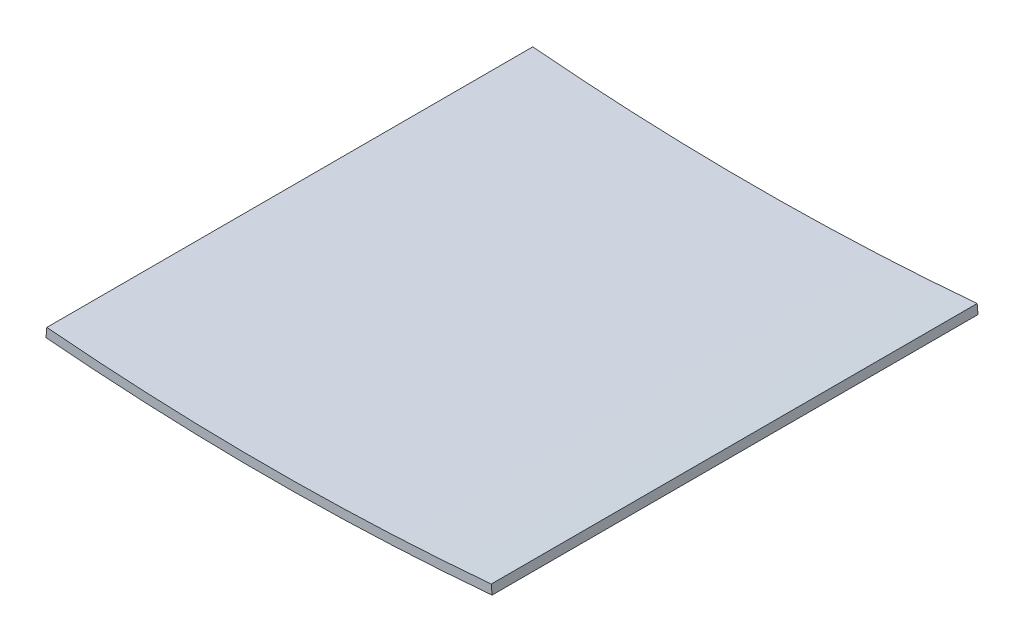
from build123d import *

# Parameters (mm, degrees)
SM_BASE_FLANGE_1_DEPTH = 105


# Sheet-metal steps are written as plain solids
with BuildPart() as part:
    # Sketch 1 → 基体-法兰1 (new body)
    with BuildSketch(Plane.XY):
        with BuildLine():
            ThreePointArc((-48.197125739, -550.895668045), (0, -553), (48.197125739, -550.895668045))
            Line((48.197125739, -550.895668045), (48.022814254, -548.903278649))
            ThreePointArc((48.022814254, -548.903278649), (0, -551), (-48.022814254, -548.903278649))
            Line((-48.022814254, -548.903278649), (-48.197125739, -550.895668045))
        make_face()
    extrude(amount=SM_BASE_FLANGE_1_DEPTH)


solid = part.part
